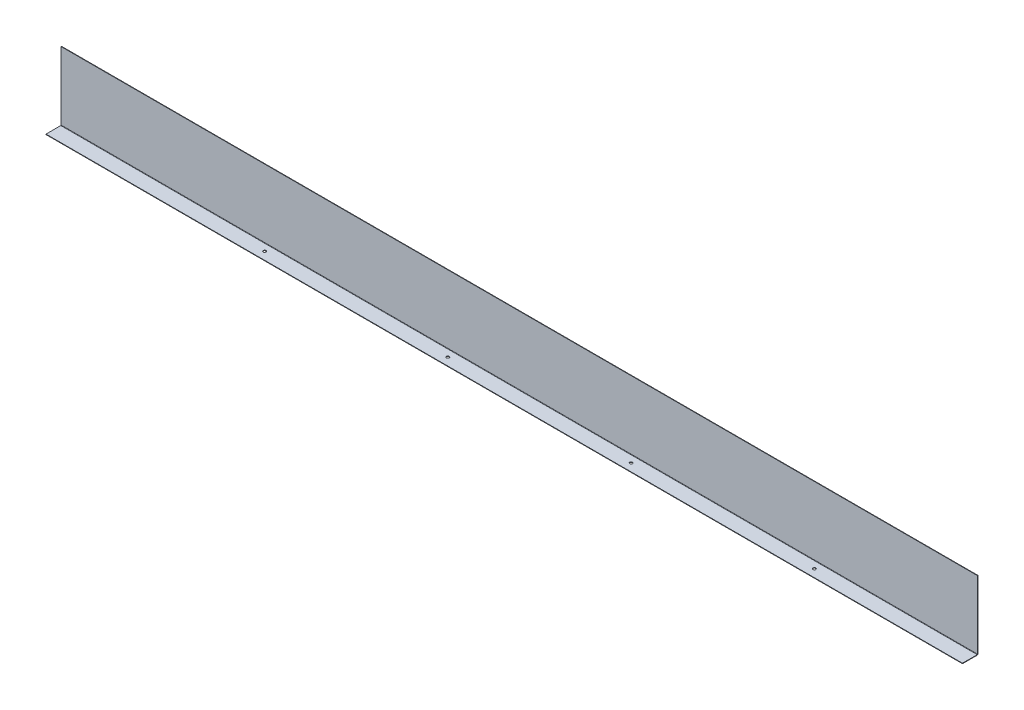
from build123d import *

# Parameters (mm, degrees)
SKETCH2_W                    = 33.9
SKETCH2_H                    = 1
BASE_FLANGE1_DEPTH           = 2000
EDGE_FLANGE2_STRIP_W         = 5.4732
EDGE_FLANGE2_STRIP_H         = 1
EDGE_FLANGE2_STRIP_CUT_DEPTH = 2000
EDGE_FLANGE2_DEPTH           = 2000
SKETCH10_R                   = 3
CUT_EXTRUDE1_DEPTH           = 10
SKETCH10_3_R                 = 3
CUT_EXTRUDE2_DEPTH           = 10


# Sheet-metal steps are written as plain solids
with BuildPart() as part:
    # Sketch2 → Base-Flange1 (new body)
    with BuildSketch(Plane(origin=(0, 0, 0), x_dir=(0, 0, -1), z_dir=(1, 0, 0))):
        with Locations((16.95, -0.5)):
            Rectangle(SKETCH2_W, SKETCH2_H)
    extrude(amount=BASE_FLANGE1_DEPTH)

    # Edge-Flange2 strip (across the edge) → Edge-Flange2 strip cut (cut)
    with BuildSketch(Plane(origin=(2000, 0, -33.9), x_dir=(0, 0, 1), z_dir=(-1, 0, 0))):
        with Locations((-1, -0.5)):
            Rectangle(EDGE_FLANGE2_STRIP_W, EDGE_FLANGE2_STRIP_H)
    extrude(amount=EDGE_FLANGE2_STRIP_CUT_DEPTH, mode=Mode.SUBTRACT)

    # Edge-Flange2 section (across the edge) → Edge-Flange2 (add)
    with BuildSketch(Plane(origin=(2000, 0, -33.9), x_dir=(0, 0, 1), z_dir=(-1, 0, 0))):
        with BuildLine():
            Line((0, 0.7366), (0, 149))
            Line((0, 149), (1, 149))
            Line((1, 149), (1, 0.7366))
            ThreePointArc((1, 0.7366), (1.215745145, 0.215745145), (1.7366, 0))
            Line((1.7366, 0), (1.7366, -1))
            ThreePointArc((1.7366, -1), (0.508638364, -0.491361636), (0, 0.7366))
        make_face()
    extrude(amount=EDGE_FLANGE2_DEPTH)

    # Sketch10 → Cut-Extrude1 (cut)
    with BuildSketch(Plane(origin=(0, 0, 0), x_dir=(1, 0, 0), z_dir=(0, 1, 0))):
        with Locations(Location((860, 16.95, 0), (0, 0, 270))):
            Circle(SKETCH10_R)
    extrude(amount=-CUT_EXTRUDE1_DEPTH, mode=Mode.SUBTRACT)

    # Sketch10<3> → Cut-Extrude2 (cut)
    with BuildSketch(Plane(origin=(0, 0, 0), x_dir=(1, 0, 0), z_dir=(0, 1, 0))):
        with Locations(Location((460, 16.95, 0), (0, 0, 270))):
            Circle(SKETCH10_3_R)
        with Locations(Location((860, 16.95, 0), (0, 0, 270))):
            Circle(SKETCH10_3_R)
        with Locations(Location((1260, 16.95, 0), (0, 0, 270))):
            Circle(SKETCH10_3_R)
        with Locations(Location((1660, 16.95, 0), (0, 0, 270))):
            Circle(SKETCH10_3_R)
    extrude(amount=-CUT_EXTRUDE2_DEPTH, mode=Mode.SUBTRACT)


solid = part.part
